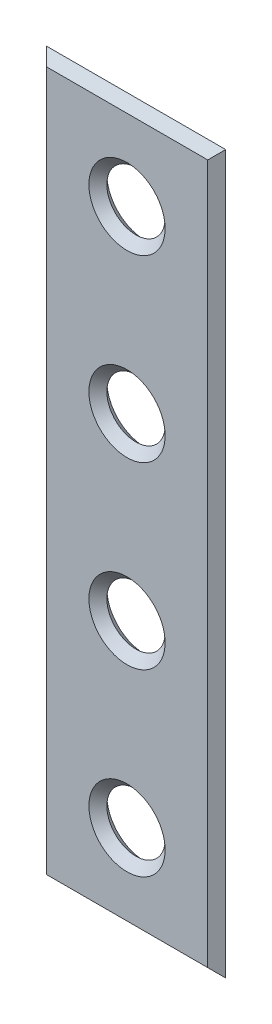
from build123d import *

# Parameters (mm, degrees)
SKETCH_1_W        = 80
SKETCH_1_H        = 320
SKETCH_1_R        = 13
EXTRUDE_324_DEPTH = 8
CHAMFER_1_SIZE    = 4


with BuildPart() as part:
    # 草图1 → Extrude 324 (new body)
    with BuildSketch(Plane.XY):
        with Locations((40, 160)):
            Rectangle(SKETCH_1_W, SKETCH_1_H)
        with Locations((40, 280)):
            Circle(SKETCH_1_R, mode=Mode.SUBTRACT)
        with Locations((40, 200)):
            Circle(SKETCH_1_R, mode=Mode.SUBTRACT)
        with Locations((40, 120)):
            Circle(SKETCH_1_R, mode=Mode.SUBTRACT)
        with Locations((40, 40)):
            Circle(SKETCH_1_R, mode=Mode.SUBTRACT)
    extrude(amount=EXTRUDE_324_DEPTH)

    # 倒角1
    chamfer_1_edges = [part.edges().sort_by_distance(p)[0] for p in [
        (27, 40, 0),
        (27, 200, 0),
        (40, 0, 0),
        (80, 160, 0),
        (40, 320, 0),
        (0, 160, 0),
        (27, 280, 0),
        (27, 120, 0),
        (27, 40, 8),
        (27, 200, 8),
        (40, 320, 8),
        (80, 160, 8),
        (40, 0, 8),
        (0, 160, 8),
        (27, 280, 8),
        (27, 120, 8),
    ]]
    chamfer(chamfer_1_edges, length=CHAMFER_1_SIZE - 0.0001)  # a hair under: the kernel refuses the full size


solid = part.part
